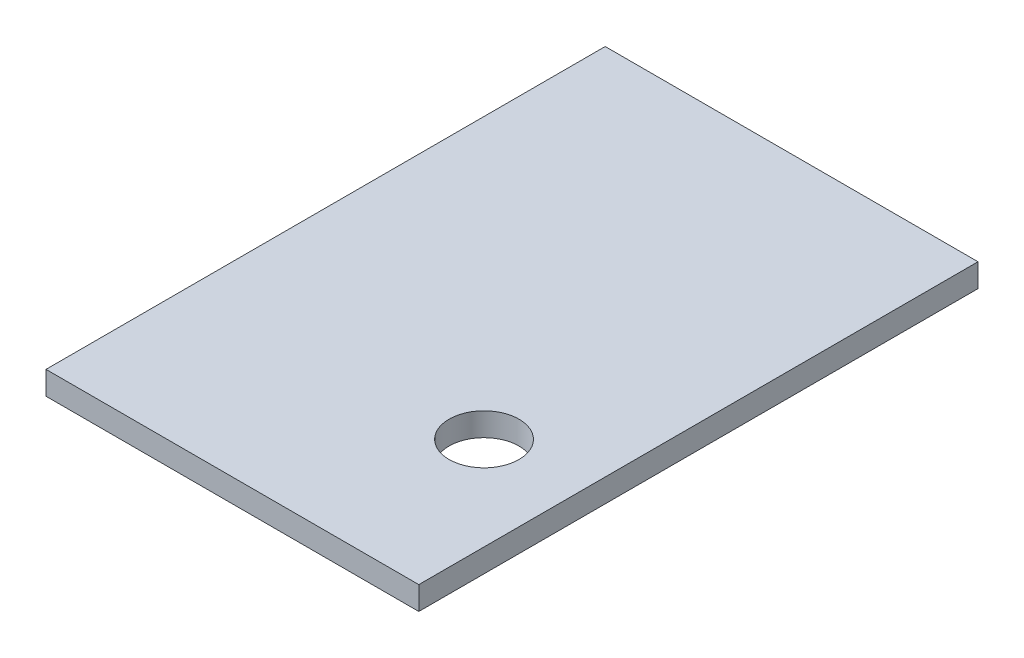
from build123d import *

# Parameters (mm, degrees)
SKETCH1_W           = 50.8
SKETCH1_H           = 76.2
BOSS_EXTRUDE1_DEPTH = 3.175
SKETCH2_R           = 4.7625
CUT_EXTRUDE1_DEPTH  = 46.900442536


with BuildPart() as part:
    # Sketch1 → Boss-Extrude1 (new body)
    with BuildSketch(Plane(origin=(0, 0, 0), x_dir=(1, 0, 0), z_dir=(0, 1, 0))):
        Rectangle(SKETCH1_W, SKETCH1_H)
    extrude(amount=BOSS_EXTRUDE1_DEPTH)

    # Sketch2 → Cut-Extrude1 (cut, through all)
    with BuildSketch(Plane(origin=(0, 3.175, 0), x_dir=(1, 0, 0), z_dir=(0, 1, 0))):
        with Locations((12.7, -16.51)):
            Circle(SKETCH2_R)
    extrude(amount=-CUT_EXTRUDE1_DEPTH, mode=Mode.SUBTRACT)


solid = part.part
